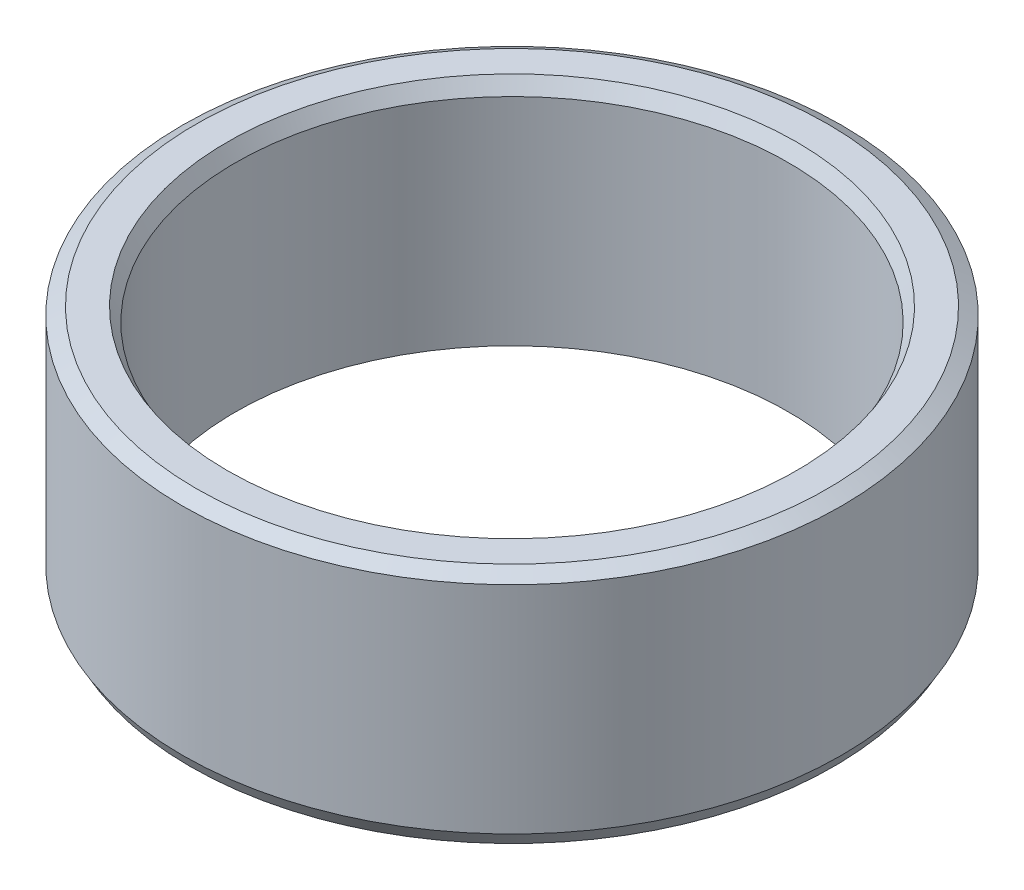
from build123d import *
from OCP.BRepFilletAPI import BRepFilletAPI_MakeChamfer

# Parameters (mm, degrees)
SKETCH1_R           = 50
BOSS_EXTRUDE1_DEPTH = 36.068199725
SKETCH2_R           = 41.947643847
CUT_EXTRUDE1_DEPTH  = 80.378303279
CHAMFER1_SIZE       = 1.218844885
CHAMFER1_SIZE2      = 2.111101267


with BuildPart() as part:
    # Sketch1 → Boss-Extrude1 (new body)
    with BuildSketch(Plane(origin=(0, 0, 0), x_dir=(1, 0, 0), z_dir=(0, 1, 0))):
        Circle(SKETCH1_R)
    extrude(amount=BOSS_EXTRUDE1_DEPTH)

    # Sketch2 → Cut-Extrude1 (cut, through all)
    with BuildSketch(Plane(origin=(0, 0, 0), x_dir=(1, 0, 0), z_dir=(0, 1, 0))):
        Circle(SKETCH2_R)
    extrude(amount=CUT_EXTRUDE1_DEPTH, mode=Mode.SUBTRACT)

    # Chamfer1: one chamfer whose edges measure the first distance from different faces: ONE call of the kernel's chamfer builder (chamfer() names one face for all edges)
    chamfer1_edges_1 = [part.edges().sort_by_distance(p)[0] for p in [
        (-41.947643847, 36.068199725, 0),
    ]]
    chamfer1_side_1 = [part.faces().sort_by_distance(p)[0] for p in [
        (-48.585786438, 36.068199725, 0),
    ]]
    chamfer1_edges_2 = [part.edges().sort_by_distance(p)[0] for p in [
        (-41.947643847, 0, 0),
    ]]
    chamfer1_side_2 = [part.faces().sort_by_distance(p)[0] for p in [
        (-41.947643847, 18.034099863, 0),
    ]]
    chamfer1_edges_3 = [part.edges().sort_by_distance(p)[0] for p in [
        (-50, 0, 0),
    ]]
    chamfer1_side_3 = [part.faces().sort_by_distance(p)[0] for p in [
        (-48.585786438, 0, 0),
    ]]
    chamfer1_edges_4 = [part.edges().sort_by_distance(p)[0] for p in [
        (-50, 36.068199725, 0),
    ]]
    chamfer1_side_4 = [part.faces().sort_by_distance(p)[0] for p in [
        (-50, 18.034099863, 0),
    ]]
    chamfer1 = BRepFilletAPI_MakeChamfer(part.part.solid().wrapped)
    for e in chamfer1_edges_1:
        chamfer1.Add(CHAMFER1_SIZE, CHAMFER1_SIZE2, e.wrapped, chamfer1_side_1[0].wrapped)  # the first distance lies on this face
    for e in chamfer1_edges_2:
        chamfer1.Add(CHAMFER1_SIZE, CHAMFER1_SIZE2, e.wrapped, chamfer1_side_2[0].wrapped)  # the first distance lies on this face
    for e in chamfer1_edges_3:
        chamfer1.Add(CHAMFER1_SIZE, CHAMFER1_SIZE2, e.wrapped, chamfer1_side_3[0].wrapped)  # the first distance lies on this face
    for e in chamfer1_edges_4:
        chamfer1.Add(CHAMFER1_SIZE, CHAMFER1_SIZE2, e.wrapped, chamfer1_side_4[0].wrapped)  # the first distance lies on this face
    add(Compound.cast(chamfer1.Shape()), mode=Mode.REPLACE)


solid = part.part
